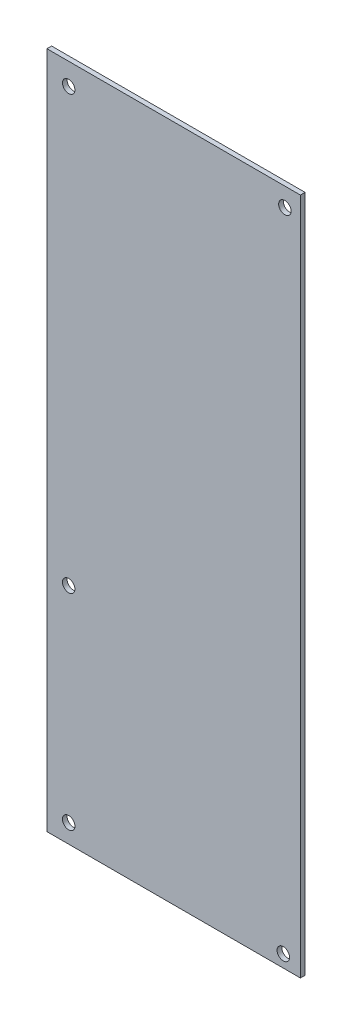
from build123d import *

# Parameters (mm, degrees)
MAIN_SKETCH_W = 81.5
MAIN_SKETCH_H = 218
MAIN_DEPTH    = 1.5
HOLE_SKETCH_R = 2
HOLE_DEPTH    = 233.741272661


with BuildPart() as part:
    # Main-Sketch → Main (new body)
    with BuildSketch(Plane.XY):
        with Locations((40.75, 109)):
            Rectangle(MAIN_SKETCH_W, MAIN_SKETCH_H)
    extrude(amount=MAIN_DEPTH)

    # Hole-Sketch → Hole (cut, through all)
    with BuildSketch(Plane.XY.offset(1.5)):
        with Locations((7, 211)):
            Circle(HOLE_SKETCH_R)
        with Locations((76.5, 212)):
            Circle(HOLE_SKETCH_R)
        with Locations((7, 6)):
            Circle(HOLE_SKETCH_R)
        with Locations((76, 4)):
            Circle(HOLE_SKETCH_R)
        with Locations((7, 72)):
            Circle(HOLE_SKETCH_R)
    extrude(amount=-HOLE_DEPTH, mode=Mode.SUBTRACT)


solid = part.part
